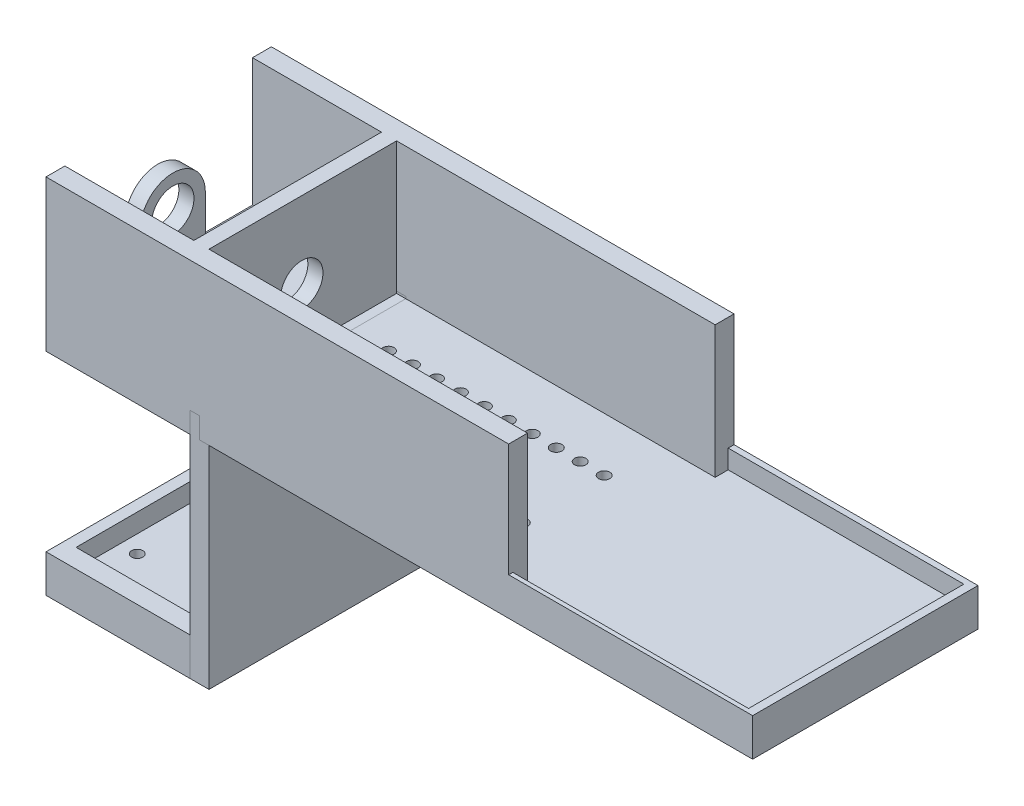
from build123d import *

# Parameters (mm, degrees)
Y_KSEKLIK_EKSTR_ZYON1_DEPTH       = 52.2
Y_KSEKLIK_EKSTR_ZYON1_DEPTH_BACK  = 7.5
BO_ALTMA1_T                       = -5
KES_EKSTR_ZYON1_DEPTH             = 5
IZIM3_W                           = 2.97
IZIM3_H                           = 49.7
Y_KSEKLIK_EKSTR_ZYON2_DEPTH       = 5
F_3_0_3_DIAMETER_HOLE1_D          = 3
F_3_0_3_DIAMETER_HOLE1_DEPTH      = 10
F_3_0_3_DIAMETER_HOLE1_TIP        = 0.901290929
F_3_0_3_DIAMETER_HOLE2_D          = 3
F_3_0_3_DIAMETER_HOLE2_DEPTH      = 10
F_3_0_3_DIAMETER_HOLE2_TIP        = 0.901290929
F_3_0_3_DIAMETER_HOLE3_D          = 3
F_3_0_3_DIAMETER_HOLE3_DEPTH      = 10
F_3_0_3_DIAMETER_HOLE3_TIP        = 0.901290929
IZIM16_R                          = 1.5
KES_EKSTR_ZYON5_DEPTH             = 2.4
IZIM18_W                          = 4
IZIM18_H                          = 21
Y_KSEKLIK_EKSTR_ZYON4_DEPTH       = 49.7
F_11_2_11_2_DIAMETER_HOLE1_REACH  = 177.753
F_11_2_11_2_DIAMETER_HOLE1_BORE_R = 5.6
L_O_ALTMA1_COUNT                  = 2
L_O_ALTMA1_PITCH                  = 34.17
IZIM26_W                          = 30.17
IZIM26_H                          = 49.7
IZIM26_W_2                        = 146.830118443
Y_KSEKLIK_EKSTR_ZYON5_DEPTH       = 10
IZIM36_W                          = 70.285556504
IZIM36_H                          = 1.468358668
Y_KSEKLIK_EKSTR_ZYON6_DEPTH       = 40
IZIM37_W                          = 54.956175628
IZIM37_H                          = 3.902922907
KES_EKSTR_ZYON16_DEPTH            = 35
IZIM41_W                          = 4
IZIM41_H                          = 49.7
Y_KSEKLIK_EKSTR_ZYON9_DEPTH       = 5
Y_KSEKLIK_EKSTR_ZYON10_DEPTH      = 5
IZIM40_W                          = 5
IZIM40_H                          = 46
KES_EKSTR_ZYON17_DEPTH            = 38.169881557
IZIM45_W                          = 6.513112222
IZIM45_H                          = 55
KES_EKSTR_ZYON19_DEPTH            = 2
IZIM47_W                          = 6.513112222
IZIM47_H                          = 55
KES_EKSTR_ZYON20_DEPTH            = 2
IZIM48_W                          = 49.7
IZIM48_H                          = 3.998378338
Y_KSEKLIK_EKSTR_ZYON12_DEPTH      = 4
KES_EKSTR_ZYON21_DEPTH            = 40
KES_EKSTR_ZYON22_START            = -35
IZIM52_W                          = 62.44399517
IZIM52_H                          = 3.442444001
IZIM52_W_2                        = 7.487819542
IZIM52_H_2                        = 3.902922907
KES_EKSTR_ZYON22_DEPTH            = 35
KES_EKSTR_ZYON23_DEPTH            = 30
KES_EKSTR_ZYON24_REACH            = 209.645
KES_EKSTR_ZYON26_DEPTH            = 5
AY_R1_SURFACE_1_BACK              = 219.674
AY_R1_SURFACE_1_DEPTH             = 439.348
AY_R1_SURFACE_2_BACK              = 219.674
AY_R1_SURFACE_2_DEPTH             = 439.348
IZIM57_W                          = 21.902880562
IZIM57_H                          = 4
IZIM57_W_2                        = 27.797119438
Y_KSEKLIK_EKSTR_ZYON13_DEPTH      = 34.17
AY_R2_SURFACE_3_BACK              = 219.674
AY_R2_SURFACE_3_DEPTH             = 439.348
AY_R2_SURFACE_4_BACK              = 219.674
AY_R2_SURFACE_4_DEPTH             = 439.348
AY_R3_START                       = -0.471945008
AY_R3_OUTLINE_W                   = 56
AY_R3_OUTLINE_H                   = 59.7
AY_R3_DEPTH                       = 5
AY_R3_2_DEPTH                     = 2.441335099
AY_R3_START_2                     = -22.832064298
AY_R3_3_DEPTH                     = 56
AY_R3_START_3                     = 33.167935702
AY_R3_4_OUTLINE_W                 = 2.441335099
AY_R3_4_OUTLINE_H                 = 26.284007216
AY_R3_4_OUTLINE_H_2               = 26.902880562
AY_R3_4_DEPTH                     = 5
AY_R3_5_OUTLINE_W                 = 4
AY_R3_5_OUTLINE_H                 = 6.513112222
AY_R3_5_DEPTH                     = 5
AY_R3_START_4                     = 38.167935702
AY_R3_6_OUTLINE_W                 = 2.441335099
AY_R3_6_OUTLINE_H                 = 5
AY_R3_6_DEPTH                     = 0.54


# Read off the part's stored shape, not the designer's step: Ayır3
with BuildPart() as part:
    # Çizim1 → Yükseklik-Ekstrüzyon1 (new, two sides: drawn at the far end of the back side and taken through both)
    with BuildSketch(Plane.XY.offset(-Y_KSEKLIK_EKSTR_ZYON1_DEPTH_BACK)):
        Polygon((-43.641826565, -22.832064298), (4.528054992, -22.832064298), (4.528054992, 33.167935702), (151.358173435, 33.167935702), (151.358173435, 63.167935702), (-43.641826565, 63.167935702), align=None)
    extrude(amount=Y_KSEKLIK_EKSTR_ZYON1_DEPTH + Y_KSEKLIK_EKSTR_ZYON1_DEPTH_BACK)

    # İç Boşaltma1
    bo_altma1_openings = [part.faces().sort_by_distance(p)[0] for p in [
        (53.858173435, 63.167935702, 22.35),
        (-43.641826565, 20.167935702, 22.35),
    ]]
    offset(amount=BO_ALTMA1_T, openings=bo_altma1_openings, kind=Kind.INTERSECTION)

    # Çizim2 → Kes-Ekstrüzyon1 (cut)
    with BuildSketch(Plane.ZY.offset(43.641826565)):
        Polygon((-2.5, -17.832064298), (-2.5, 63.167935702), (-7.5, 63.167935702), (-7.5, -22.832064298), (52.2, -22.832064298), (52.2, 63.167935702), (47.2, 63.167935702), (47.2, -17.832064298), align=None)
    extrude(amount=-KES_EKSTR_ZYON1_DEPTH, mode=Mode.SUBTRACT)

    # Çizim3 → Yükseklik-Ekstrüzyon2 (add)
    with BuildSketch(Plane(origin=(0, -17.832064298, 0), x_dir=(1, 0, 0), z_dir=(0, 1, 0))):
        with Locations((-37.156826565, -22.35)):
            Rectangle(IZIM3_W, IZIM3_H)
    extrude(amount=Y_KSEKLIK_EKSTR_ZYON2_DEPTH)

    # Ø3.0 (3) Diameter Hole1
    with Locations(Plane(origin=(-31.071885787, -17.832064298, 9.6), x_dir=(0, 0, 1), z_dir=(0, 1, 0))):
        with Locations((0, 0), (0, 26), (26, 26), (26, 0)):
            Hole(F_3_0_3_DIAMETER_HOLE1_D / 2, depth=F_3_0_3_DIAMETER_HOLE1_DEPTH)
            with Locations((0, 0, -(F_3_0_3_DIAMETER_HOLE1_DEPTH + F_3_0_3_DIAMETER_HOLE1_TIP / 2))):  # 118° drill point
                Cone(0, F_3_0_3_DIAMETER_HOLE1_D / 2, F_3_0_3_DIAMETER_HOLE1_TIP, mode=Mode.SUBTRACT)

    # Ø3.0 (3) Diameter Hole2
    with Locations(Plane(origin=(11.621931626, 38.167935702, 11.75), x_dir=(0, 0, 1), z_dir=(0, 1, 0))):
        with Locations((0, 0), (0, 6.35), (0, 12.7), (0, 19.05), (0, 25.4), (0, 31.75), (0, 38.1), (0, 44.45), (0, 50.8), (0, 57.15), (21.7, 57.15), (21.7, 50.8), (21.7, 44.45), (21.7, 38.1), (21.7, 31.75)):
            Hole(F_3_0_3_DIAMETER_HOLE2_D / 2, depth=F_3_0_3_DIAMETER_HOLE2_DEPTH)
            with Locations((0, 0, -(F_3_0_3_DIAMETER_HOLE2_DEPTH + F_3_0_3_DIAMETER_HOLE2_TIP / 2))):  # 118° drill point
                Cone(0, F_3_0_3_DIAMETER_HOLE2_D / 2, F_3_0_3_DIAMETER_HOLE2_TIP, mode=Mode.SUBTRACT)

    # Ø3.0 (3) Diameter Hole3
    with Locations(Plane(origin=(11.621931626, 38.167935702, 33.45), x_dir=(0, 0, 1), z_dir=(0, 1, 0))):
        with Locations((0, 0), (0, 6.35), (0, 12.7), (0, 19.05), (0, 25.4)):
            Hole(F_3_0_3_DIAMETER_HOLE3_D / 2, depth=F_3_0_3_DIAMETER_HOLE3_DEPTH)
            with Locations((0, 0, -(F_3_0_3_DIAMETER_HOLE3_DEPTH + F_3_0_3_DIAMETER_HOLE3_TIP / 2))):  # 118° drill point
                Cone(0, F_3_0_3_DIAMETER_HOLE3_D / 2, F_3_0_3_DIAMETER_HOLE3_TIP, mode=Mode.SUBTRACT)

    # Çizim16 → Kes-Ekstrüzyon5 (cut)
    # profile 1 of 20: a face of its own
    with BuildSketch(Plane.XZ.offset(-33.167935702)):
        Polygon((62.421931626, 30.445), (65.024337965, 31.9475), (65.024337965, 34.9525), (62.421931626, 36.455), (59.819525288, 34.9525), (59.819525288, 31.9475), align=None)
        with Locations(Location((62.421931626, 33.45, 0), (0, 0, 90))):
            Circle(IZIM16_R, mode=Mode.SUBTRACT)
    # profile 2 of 20: a face of its own
    with BuildSketch(Plane.XZ.offset(-33.167935702)):
        Polygon((56.071931626, 30.445), (58.674337965, 31.9475), (58.674337965, 34.9525), (56.071931626, 36.455), (53.469525288, 34.9525), (53.469525288, 31.9475), align=None)
        with Locations(Location((56.071931626, 33.45, 0), (0, 0, 90))):
            Circle(IZIM16_R, mode=Mode.SUBTRACT)
    # profile 3 of 20: a face of its own
    with BuildSketch(Plane.XZ.offset(-33.167935702)):
        Polygon((49.721931626, 30.445), (52.324337965, 31.9475), (52.324337965, 34.9525), (49.721931626, 36.455), (47.119525288, 34.9525), (47.119525288, 31.9475), align=None)
        with Locations(Location((49.721931626, 33.45, 0), (0, 0, 90))):
            Circle(IZIM16_R, mode=Mode.SUBTRACT)
    # profile 4 of 20: a face of its own
    with BuildSketch(Plane.XZ.offset(-33.167935702)):
        Polygon((71.374337965, 31.9475), (71.374337965, 34.9525), (68.771931626, 36.455), (66.169525288, 34.9525), (66.169525288, 31.9475), (68.771931626, 30.445), align=None)
        with Locations(Location((68.771931626, 33.45, 0), (0, 0, 90))):
            Circle(IZIM16_R, mode=Mode.SUBTRACT)
    # profile 5 of 20: a face of its own
    with BuildSketch(Plane.XZ.offset(-33.167935702)):
        Polygon((43.371931626, 30.445), (45.974337965, 31.9475), (45.974337965, 34.9525), (43.371931626, 36.455), (40.769525288, 34.9525), (40.769525288, 31.9475), align=None)
        with Locations(Location((43.371931626, 33.45, 0), (0, 0, 90))):
            Circle(IZIM16_R, mode=Mode.SUBTRACT)
    # profile 6 of 20: a face of its own
    with BuildSketch(Plane.XZ.offset(-33.167935702)):
        Polygon((37.021931626, 30.445), (39.624337965, 31.9475), (39.624337965, 34.9525), (37.021931626, 36.455), (34.419525288, 34.9525), (34.419525288, 31.9475), align=None)
        with Locations(Location((37.021931626, 33.45, 0), (0, 0, 90))):
            Circle(IZIM16_R, mode=Mode.SUBTRACT)
    # profile 7 of 20: a face of its own
    with BuildSketch(Plane.XZ.offset(-33.167935702)):
        Polygon((30.671931626, 30.445), (33.274337965, 31.9475), (33.274337965, 34.9525), (30.671931626, 36.455), (28.069525288, 34.9525), (28.069525288, 31.9475), align=None)
        with Locations(Location((30.671931626, 33.45, 0), (0, 0, 90))):
            Circle(IZIM16_R, mode=Mode.SUBTRACT)
    # profile 8 of 20: a face of its own
    with BuildSketch(Plane.XZ.offset(-33.167935702)):
        Polygon((24.321931626, 30.445), (26.924337965, 31.9475), (26.924337965, 34.9525), (24.321931626, 36.455), (21.719525288, 34.9525), (21.719525288, 31.9475), align=None)
        with Locations(Location((24.321931626, 33.45, 0), (0, 0, 90))):
            Circle(IZIM16_R, mode=Mode.SUBTRACT)
    # profile 9 of 20: a face of its own
    with BuildSketch(Plane.XZ.offset(-33.167935702)):
        Polygon((17.971931626, 30.445), (20.574337965, 31.9475), (20.574337965, 34.9525), (17.971931626, 36.455), (15.369525288, 34.9525), (15.369525288, 31.9475), align=None)
        with Locations(Location((17.971931626, 33.45, 0), (0, 0, 90))):
            Circle(IZIM16_R, mode=Mode.SUBTRACT)
    # profile 10 of 20: a face of its own
    with BuildSketch(Plane.XZ.offset(-33.167935702)):
        Polygon((11.621931626, 30.445), (14.224337965, 31.9475), (14.224337965, 34.9525), (11.621931626, 36.455), (9.019525288, 34.9525), (9.019525288, 31.9475), align=None)
        with Locations(Location((11.621931626, 33.45, 0), (0, 0, 90))):
            Circle(IZIM16_R, mode=Mode.SUBTRACT)
    # profile 11 of 20: a face of its own
    with BuildSketch(Plane.XZ.offset(-33.167935702)):
        Polygon((11.621931626, 8.745), (14.224337965, 10.2475), (14.224337965, 13.2525), (11.621931626, 14.755), (9.019525288, 13.2525), (9.019525288, 10.2475), align=None)
        with Locations(Location((11.621931626, 11.75, 0), (0, 0, 90))):
            Circle(IZIM16_R, mode=Mode.SUBTRACT)
    # profile 12 of 20: a face of its own
    with BuildSketch(Plane.XZ.offset(-33.167935702)):
        Polygon((17.971931626, 8.745), (20.574337965, 10.2475), (20.574337965, 13.2525), (17.971931626, 14.755), (15.369525288, 13.2525), (15.369525288, 10.2475), align=None)
        with Locations(Location((17.971931626, 11.75, 0), (0, 0, 90))):
            Circle(IZIM16_R, mode=Mode.SUBTRACT)
    # profile 13 of 20: a face of its own
    with BuildSketch(Plane.XZ.offset(-33.167935702)):
        Polygon((24.321931626, 8.745), (26.924337965, 10.2475), (26.924337965, 13.2525), (24.321931626, 14.755), (21.719525288, 13.2525), (21.719525288, 10.2475), align=None)
        with Locations(Location((24.321931626, 11.75, 0), (0, 0, 90))):
            Circle(IZIM16_R, mode=Mode.SUBTRACT)
    # profile 14 of 20: a face of its own
    with BuildSketch(Plane.XZ.offset(-33.167935702)):
        Polygon((30.671931626, 8.745), (33.274337965, 10.2475), (33.274337965, 13.2525), (30.671931626, 14.755), (28.069525288, 13.2525), (28.069525288, 10.2475), align=None)
        with Locations(Location((30.671931626, 11.75, 0), (0, 0, 90))):
            Circle(IZIM16_R, mode=Mode.SUBTRACT)
    # profile 15 of 20: a face of its own
    with BuildSketch(Plane.XZ.offset(-33.167935702)):
        Polygon((37.021931626, 8.745), (39.624337965, 10.2475), (39.624337965, 13.2525), (37.021931626, 14.755), (34.419525288, 13.2525), (34.419525288, 10.2475), align=None)
        with Locations(Location((37.021931626, 11.75, 0), (0, 0, 90))):
            Circle(IZIM16_R, mode=Mode.SUBTRACT)
    # profile 16 of 20: a face of its own
    with BuildSketch(Plane.XZ.offset(-33.167935702)):
        Polygon((43.371931626, 8.745), (45.974337965, 10.2475), (45.974337965, 13.2525), (43.371931626, 14.755), (40.769525288, 13.2525), (40.769525288, 10.2475), align=None)
        with Locations(Location((43.371931626, 11.75, 0), (0, 0, 90))):
            Circle(IZIM16_R, mode=Mode.SUBTRACT)
    # profile 17 of 20: a face of its own
    with BuildSketch(Plane.XZ.offset(-33.167935702)):
        Polygon((49.721931626, 8.745), (52.324337965, 10.2475), (52.324337965, 13.2525), (49.721931626, 14.755), (47.119525288, 13.2525), (47.119525288, 10.2475), align=None)
        with Locations(Location((49.721931626, 11.75, 0), (0, 0, 90))):
            Circle(IZIM16_R, mode=Mode.SUBTRACT)
    # profile 18 of 20: a face of its own
    with BuildSketch(Plane.XZ.offset(-33.167935702)):
        Polygon((56.071931626, 8.745), (58.674337965, 10.2475), (58.674337965, 13.2525), (56.071931626, 14.755), (53.469525288, 13.2525), (53.469525288, 10.2475), align=None)
        with Locations(Location((56.071931626, 11.75, 0), (0, 0, 90))):
            Circle(IZIM16_R, mode=Mode.SUBTRACT)
    # profile 19 of 20: a face of its own
    with BuildSketch(Plane.XZ.offset(-33.167935702)):
        Polygon((62.421931626, 8.745), (65.024337965, 10.2475), (65.024337965, 13.2525), (62.421931626, 14.755), (59.819525288, 13.2525), (59.819525288, 10.2475), align=None)
        with Locations(Location((62.421931626, 11.75, 0), (0, 0, 90))):
            Circle(IZIM16_R, mode=Mode.SUBTRACT)
    # profile 20 of 20: a face of its own
    with BuildSketch(Plane.XZ.offset(-33.167935702)):
        Polygon((68.771931626, 8.745), (71.374337965, 10.2475), (71.374337965, 13.2525), (68.771931626, 14.755), (66.169525288, 13.2525), (66.169525288, 10.2475), align=None)
        with Locations(Location((68.771931626, 11.75, 0), (0, 0, 90))):
            Circle(IZIM16_R, mode=Mode.SUBTRACT)
    extrude(amount=-KES_EKSTR_ZYON5_DEPTH, mode=Mode.SUBTRACT)

    # Çizim18 → Yükseklik-Ekstrüzyon4 (add)
    with BuildSketch(Plane.XY.offset(-2.5)):
        with Locations((-2.471945008, 52.667935702)):
            Rectangle(IZIM18_W, IZIM18_H)
    y_kseklik_ekstr_zyon4 = extrude(amount=Y_KSEKLIK_EKSTR_ZYON4_DEPTH)

    # Ø11.2 (11.2) Diameter Hole1 bore (on position points) → Ø11.2 (11.2) Diameter Hole1 (cut, up to next)
    with BuildSketch(Plane(origin=(-4.471945008, 52.667935702, 22.6), x_dir=(0, -1, 0), z_dir=(-1, 0, 0)), mode=Mode.PRIVATE) as f_11_2_11_2_diameter_hole1_sk1:
        Circle(F_11_2_11_2_DIAMETER_HOLE1_BORE_R)
    f_11_2_11_2_diameter_hole1_tool1 = extrude(f_11_2_11_2_diameter_hole1_sk1.sketch, amount=-F_11_2_11_2_DIAMETER_HOLE1_REACH, mode=Mode.PRIVATE) & part.part
    f_11_2_11_2_diameter_hole1 = f_11_2_11_2_diameter_hole1_tool1.solids().sort_by_distance((-4.471945, 52.667936, 22.6))[0]
    add(f_11_2_11_2_diameter_hole1, mode=Mode.SUBTRACT)

    # LÇoğaltma1: Yükseklik-Ekstrüzyon4, Ø11.2 (11.2) Diameter Hole1 ×2
    with Locations(*[(-i * L_O_ALTMA1_PITCH, 0, 0) for i in range(1, L_O_ALTMA1_COUNT)]):
        add(y_kseklik_ekstr_zyon4)
        add(f_11_2_11_2_diameter_hole1, mode=Mode.SUBTRACT)

    # Çizim26 → Yükseklik-Ekstrüzyon5 (add)
    with BuildSketch(Plane(origin=(0, 63.167935702, 0), x_dir=(1, 0, 0), z_dir=(0, 1, 0))):
        Polygon((-38.641945008, 2.5), (-38.641945008, -47.2), (-38.641826565, -52.2), (151.358173435, -52.2), (151.358173435, 7.5), (-38.641826565, 7.5), align=None)
        with Locations((-19.556945008, -22.35)):
            Rectangle(IZIM26_W, IZIM26_H, mode=Mode.SUBTRACT)
        with Locations((72.943114213, -22.35)):
            Rectangle(IZIM26_W_2, IZIM26_H, mode=Mode.SUBTRACT)
    extrude(amount=Y_KSEKLIK_EKSTR_ZYON5_DEPTH)

    # Çizim36 → Yükseklik-Ekstrüzyon6 (add)
    with BuildSketch(Plane.XZ.offset(-33.167935702)):
        with Locations((116.215395183, 52.934179334)):
            Rectangle(IZIM36_W, IZIM36_H)
        with Locations((116.215395183, -8.234179334)):
            Rectangle(IZIM36_W, IZIM36_H)
    extrude(amount=-Y_KSEKLIK_EKSTR_ZYON6_DEPTH)

    # Çizim37 → Kes-Ekstrüzyon16 (cut)
    with BuildSketch(Plane(origin=(0, 73.167935702, 0), x_dir=(1, 0, 0), z_dir=(0, 1, 0))):
        with Locations((111.392266079, -49.151461454)):
            Rectangle(IZIM37_W, IZIM37_H)
        Polygon((-38.641945008, 2.5), (-38.641826565, 2.5), (-38.641826565, 7.5), align=None)
        Polygon((-38.641826565, -52.2), (-38.641826565, -47.2), (-38.641945008, -47.2), align=None)
    extrude(amount=-KES_EKSTR_ZYON16_DEPTH, mode=Mode.SUBTRACT)

    # Çizim41 → Yükseklik-Ekstrüzyon9 (add)
    with BuildSketch(Plane.XZ.offset(-42.167935702)):
        with Locations((-2.471945008, 22.35)):
            Rectangle(IZIM41_W, IZIM41_H)
    extrude(amount=Y_KSEKLIK_EKSTR_ZYON9_DEPTH)

    # Çizim42 → Yükseklik-Ekstrüzyon10 (add)
    with BuildSketch(Plane.XZ.offset(-42.167935702)):
        Polygon((-34.641945008, -2.5), (-34.641945008, 47.2), (-38.641826565, 47.2), (-38.641945008, -2.5), align=None)
    extrude(amount=Y_KSEKLIK_EKSTR_ZYON10_DEPTH)

    # Çizim40 → Kes-Ekstrüzyon17 (cut)
    with BuildSketch(Plane.ZY.offset(38.641826565)):
        with Locations((-5, 10.167935702)):
            Rectangle(IZIM40_W, IZIM40_H)
        with Locations((49.7, 10.167935702)):
            Rectangle(IZIM40_W, IZIM40_H)
    extrude(amount=-KES_EKSTR_ZYON17_DEPTH, mode=Mode.SUBTRACT)

    # Çizim45 → Kes-Ekstrüzyon19 (cut)
    with BuildSketch(Plane.ZY.offset(0.471945008)):
        with Locations((22.659436673, 9.667935702)):
            Rectangle(IZIM45_W, IZIM45_H)
    extrude(amount=-KES_EKSTR_ZYON19_DEPTH, mode=Mode.SUBTRACT)

    # Çizim47 → Kes-Ekstrüzyon20 (cut)
    with BuildSketch(Plane.ZY.offset(-1.528054992)):
        with Locations((22.659436673, 9.667935702)):
            Rectangle(IZIM47_W, IZIM47_H)
    extrude(amount=-KES_EKSTR_ZYON20_DEPTH, mode=Mode.SUBTRACT)

    # Çizim48 → Yükseklik-Ekstrüzyon12 (add)
    with BuildSketch(Plane(origin=(-34.641945008, 0, 0), x_dir=(0, 0, -1), z_dir=(1, 0, 0))):
        with Locations((-22.35, 35.168746533)):
            Rectangle(IZIM48_W, IZIM48_H)
    extrude(amount=-Y_KSEKLIK_EKSTR_ZYON12_DEPTH)

    # Çizim51 → Kes-Ekstrüzyon21 (cut)
    with BuildSketch(Plane(origin=(0, 73.167935702, 0), x_dir=(1, 0, 0), z_dir=(0, 1, 0))):
        Polygon((148.542538403, -52.2), (148.542538403, -51.102922907), (148.542538403, 7.5), (81.072616931, 7.5), (81.072616931, 8.968358668), (151.358173435, 8.968358668), (151.358173435, -53.668358668), (81.072616931, -53.668358668), (81.072616931, -52.2), align=None)
    extrude(amount=-KES_EKSTR_ZYON21_DEPTH, mode=Mode.SUBTRACT)

    # Çizim52 → Kes-Ekstrüzyon22 (cut)
    with BuildSketch(Plane(origin=(0, 73.167935702, 0), x_dir=(-1, 0, 0), z_dir=(0, 1, 0)).offset(KES_EKSTR_ZYON22_START)):
        with Locations((-115.13617585, -4.221222001)):
            Rectangle(IZIM52_W, IZIM52_H)
        with Locations((-142.614263664, 49.151461454)):
            Rectangle(IZIM52_W_2, IZIM52_H_2)
    extrude(amount=KES_EKSTR_ZYON22_DEPTH, mode=Mode.SUBTRACT)

    # Çizim53 → Kes-Ekstrüzyon23 (cut)
    with BuildSketch(Plane(origin=(0, 73.167935702, 0), x_dir=(1, 0, 0), z_dir=(0, 1, 0))):
        Polygon((83.914178265, 5.942444001), (146.358173435, 5.942444001), (146.358173435, -51.102922907), (83.914178265, -51.102922907), (83.914178265, -52.2), (148.542538403, -52.2), (148.542538403, 7.5), (83.914178265, 7.5), align=None)
    extrude(amount=-KES_EKSTR_ZYON23_DEPTH, mode=Mode.SUBTRACT)

    # Çizim54 → Kes-Ekstrüzyon24 (cut, up to next)
    with BuildSketch(Plane.ZY.offset(38.641945008), mode=Mode.PRIVATE) as kes_ekstr_zyon24_sk1:
        with BuildLine():
            Line((14.000516357, 39.355310379), (14.000516357, 52.667935702))
            ThreePointArc((14.000516357, 52.667935702), (22.6, 61.267419345), (31.199483643, 52.667935702))
            Line((31.199483643, 52.667935702), (31.199483643, 39.355310379))
            Line((31.199483643, 39.355310379), (47.2, 39.355310379))
            Line((47.2, 39.355310379), (47.2, 73.167935702))
            Line((47.2, 73.167935702), (-2.5, 73.167935702))
            Line((-2.5, 73.167935702), (-2.5, 39.355310379))
            Line((-2.5, 39.355310379), (14.000516357, 39.355310379))
        make_face()
    kes_ekstr_zyon24_tool1 = extrude(kes_ekstr_zyon24_sk1.sketch, amount=-KES_EKSTR_ZYON24_REACH, mode=Mode.PRIVATE) & part.part
    add(kes_ekstr_zyon24_tool1.solids().sort_by_distance((-38.641945, 56.261623, -1.898886))[0], mode=Mode.SUBTRACT)

    # Çizim56 → Kes-Ekstrüzyon26 (cut)
    with BuildSketch(Plane.XZ.offset(-37.167935702)):
        Polygon((-4.471945008, 19.402880562), (-0.471945008, 19.402880562), (3.528054992, 19.402880562), (3.528054992, 25.915992784), (-0.471945008, 25.915992784), (-4.471945008, 25.915992784), align=None)
    extrude(amount=-KES_EKSTR_ZYON26_DEPTH, mode=Mode.SUBTRACT)


with BuildPart() as body_2:
    # Ayır1: the piece behind the surface
    add(part.part)
    # Ayır1 surface: a surface, the sketch's curves swept straight by 439.348 mm
    with BuildLine(Plane.XY.offset(52.2).offset(-AY_R1_SURFACE_1_BACK), mode=Mode.PRIVATE) as ay_r1_surface_1_path:
        Line((-0.471945008, 33.167935702), (-0.471945008, 38.707935702))
        Line((-0.471945008, 38.707935702), (1.969390091, 38.707935702))
        Line((1.969390091, 38.707935702), (1.969390091, 33.167935702))
        Line((1.969390091, 33.167935702), (4.528054992, 33.167935702))
    ay_r1_surface_1 = Shell.extrude(ay_r1_surface_1_path.wire(), (0 * AY_R1_SURFACE_1_DEPTH, 0 * AY_R1_SURFACE_1_DEPTH, 1 * AY_R1_SURFACE_1_DEPTH))
    split(bisect_by=ay_r1_surface_1, keep=Keep.BOTTOM)


with BuildPart() as part_1:
    add(part.part)

    # Ayır1: split by a surface, the side it looks to stays
    # Ayır1 surface: a surface, the sketch's curves swept straight by 439.348 mm
    with BuildLine(Plane.XY.offset(52.2).offset(-AY_R1_SURFACE_2_BACK), mode=Mode.PRIVATE) as ay_r1_surface_2_path:
        Line((-0.471945008, 33.167935702), (-0.471945008, 38.707935702))
        Line((-0.471945008, 38.707935702), (1.969390091, 38.707935702))
        Line((1.969390091, 38.707935702), (1.969390091, 33.167935702))
        Line((1.969390091, 33.167935702), (4.528054992, 33.167935702))
    ay_r1_surface_2 = Shell.extrude(ay_r1_surface_2_path.wire(), (0 * AY_R1_SURFACE_2_DEPTH, 0 * AY_R1_SURFACE_2_DEPTH, 1 * AY_R1_SURFACE_2_DEPTH))
    split(bisect_by=ay_r1_surface_2, keep=Keep.TOP)

    add(body_2.part)  # Yükseklik-Ekstrüzyon13 merges body 2
    # Çizim57 → Yükseklik-Ekstrüzyon13 (add)
    with BuildSketch(Plane.ZY.offset(0.471945008)):
        with Locations((8.451440281, 35.167935702)):
            Rectangle(IZIM57_W, IZIM57_H)
        with Locations((33.301440281, 35.167935702)):
            Rectangle(IZIM57_W_2, IZIM57_H)
    extrude(amount=Y_KSEKLIK_EKSTR_ZYON13_DEPTH)


with BuildPart() as body_2_2:
    # Ayır2: the piece behind the surface
    add(part_1.part)
    # Ayır2 surface: a surface, the sketch's curves swept straight by 439.348 mm
    with BuildLine(Plane(origin=(0, 0, -7.5), x_dir=(-1, 0, 0), z_dir=(0, 0, -1)).offset(-AY_R2_SURFACE_3_BACK), mode=Mode.PRIVATE) as ay_r2_surface_3_path:
        Line((0.471945008, -12.832064298), (0.471945008, -22.832064298))
    ay_r2_surface_3 = Shell.extrude(ay_r2_surface_3_path.wire(), (0 * AY_R2_SURFACE_3_DEPTH, 0 * AY_R2_SURFACE_3_DEPTH, -1 * AY_R2_SURFACE_3_DEPTH))
    split(bisect_by=ay_r2_surface_3, keep=Keep.BOTTOM)

    # Ayır3 outline → Ayır3 (cut)
    with BuildSketch(Plane.YZ.offset(AY_R3_START)):
        with Locations((5.167935702, 22.35)):
            Rectangle(AY_R3_OUTLINE_W, AY_R3_OUTLINE_H)
    extrude(amount=AY_R3_DEPTH, mode=Mode.SUBTRACT)

    # Ay_r3 2 outline → Ay_r3 2 (cut)
    with BuildSketch(Plane.YZ.offset(AY_R3_START)):
        Polygon((38.707935702, -7.5), (38.707935702, -2.5), (38.167935702, -2.5), (38.167935702, 19.402880562), (33.167935702, 19.402880562), (33.167935702, -7.5), align=None)
        Polygon((33.167935702, 25.915992784), (38.167935702, 25.915992784), (38.167935702, 47.2), (38.707935702, 47.2), (38.707935702, 52.2), (33.167935702, 52.2), align=None)
    extrude(amount=AY_R3_2_DEPTH, mode=Mode.SUBTRACT)


with BuildPart() as part_2:
    add(part_1.part)

    # Ayır2: split by a surface, the side it looks to stays
    # Ayır2 surface: a surface, the sketch's curves swept straight by 439.348 mm
    with BuildLine(Plane(origin=(0, 0, -7.5), x_dir=(-1, 0, 0), z_dir=(0, 0, -1)).offset(-AY_R2_SURFACE_4_BACK), mode=Mode.PRIVATE) as ay_r2_surface_4_path:
        Line((0.471945008, -12.832064298), (0.471945008, -22.832064298))
    ay_r2_surface_4 = Shell.extrude(ay_r2_surface_4_path.wire(), (0 * AY_R2_SURFACE_4_DEPTH, 0 * AY_R2_SURFACE_4_DEPTH, -1 * AY_R2_SURFACE_4_DEPTH))
    split(bisect_by=ay_r2_surface_4, keep=Keep.TOP)


with BuildPart() as body_3:
    # Ay_r3 3 outline → Ay_r3 3 (new body)
    with BuildSketch(Plane(origin=(0, 0, 0), x_dir=(1, 0, 0), z_dir=(0, 1, 0)).offset(AY_R3_START_2)):
        Polygon((3.528054992, -25.915992784), (-0.471945008, -25.915992784), (-0.471945008, -52.2), (4.528054992, -52.2), (4.528054992, 7.5), (-0.471945008, 7.5), (-0.471945008, -19.402880562), (3.528054992, -19.402880562), align=None)
    extrude(amount=AY_R3_3_DEPTH)

    # Ay_r3 4 outline → Ay_r3 4 (add)
    with BuildSketch(Plane(origin=(0, 0, 0), x_dir=(1, 0, 0), z_dir=(0, 1, 0)).offset(AY_R3_START_3)):
        with Locations((0.748722542, -39.057996392)):
            Rectangle(AY_R3_4_OUTLINE_W, AY_R3_4_OUTLINE_H)
        with Locations((0.748722542, -5.951440281)):
            Rectangle(AY_R3_4_OUTLINE_W, AY_R3_4_OUTLINE_H_2)
    extrude(amount=AY_R3_4_DEPTH)

    # Ay_r3 5 outline → Ay_r3 5 (add)
    with BuildSketch(Plane(origin=(0, 0, 0), x_dir=(1, 0, 0), z_dir=(0, 1, 0)).offset(AY_R3_START_2)):
        with Locations((1.528054992, -22.659436673)):
            Rectangle(AY_R3_5_OUTLINE_W, AY_R3_5_OUTLINE_H)
    extrude(amount=AY_R3_5_DEPTH)

    # Ay_r3 6 outline → Ay_r3 6 (add)
    with BuildSketch(Plane(origin=(0, 0, 0), x_dir=(1, 0, 0), z_dir=(0, 1, 0)).offset(AY_R3_START_4)):
        with Locations((0.748722542, -49.7)):
            Rectangle(AY_R3_6_OUTLINE_W, AY_R3_6_OUTLINE_H)
        with Locations((0.748722542, 5)):
            Rectangle(AY_R3_6_OUTLINE_W, AY_R3_6_OUTLINE_H)
    extrude(amount=AY_R3_6_DEPTH)


solid = Compound([body_2_2.part, part_2.part, body_3.part])
